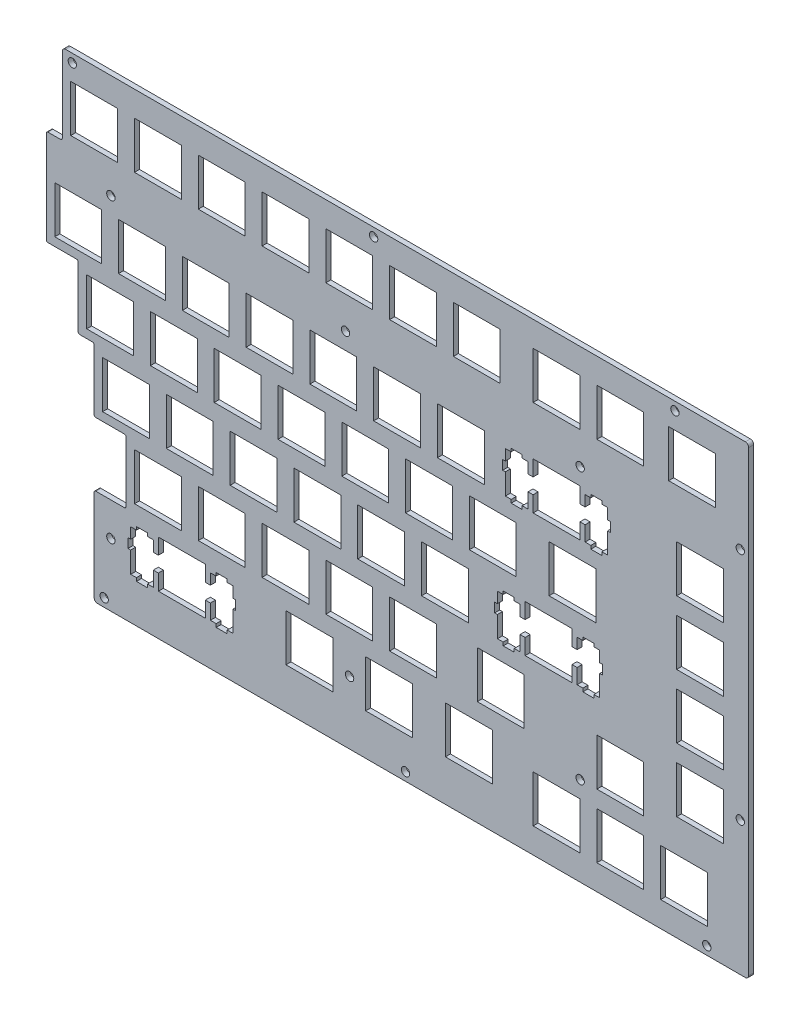
from build123d import *

# Parameters (mm, degrees)
MODEL_W                = 13.999
MODEL_H                = 13.99947
MODEL_W_2              = 13.9993
MODEL_H_2              = 13.99948
MODEL_W_3              = 14.0009
MODEL_H_3              = 13.9994
MODEL_W_4              = 14
MODEL_W_5              = 13.9994
MODEL_H_4              = 13.9992
MODEL_W_6              = 13.9998
MODEL_W_7              = 13.99955
MODEL_W_8              = 14.0007
MODEL_W_9              = 14.001
MODEL_W_10             = 13.99954
MODEL_H_5              = 13.999
EXTRUDE_1_DEPTH        = 1.5
EXTRUDE_2_DEPTH        = 1.5
SKETCH_2_R             = 1.25
CUT_EXTRUDE_1_DEPTH    = 3
FILLET_1_R             = 1
PATTERN_LINEAR_1_COUNT = 3
PATTERN_LINEAR_1_PITCH = 90
SKETCH_3_R             = 1.25
CUT_EXTRUDE_2_DEPTH    = 3
PATTERN_LINEAR_2_COUNT = 3
PATTERN_LINEAR_2_PITCH = 70
FILLET_2_R             = 0.5
SKETCH_4_R             = 1.25
CUT_EXTRUDE_3_DEPTH    = 10


with BuildPart() as part:
    # Model → 凸台-拉伸1 (new body)
    with BuildSketch(Plane.XY):
        Polygon((4.85693, 129.021), (204.883, 129.021), (204.883, 0.434082), (14.38193, 0.434082), (14.38193, 24.241), (23.90693, 24.241), (23.90693, 43.291), (14.38193, 43.291), (14.38193, 62.341), (9.61893, 62.341), (9.61893, 81.391), (0.09393, 81.391), (0.09393, 109.971), (4.85693, 109.971), align=None)
        with Locations((152.4945, 9.959765)):
            Rectangle(MODEL_W, MODEL_H, mode=Mode.SUBTRACT)
        with Locations((171.5445, 9.959765)):
            Rectangle(MODEL_W, MODEL_H, mode=Mode.SUBTRACT)
        with Locations((190.5945, 9.959765)):
            Rectangle(MODEL_W, MODEL_H, mode=Mode.SUBTRACT)
        Polygon((33.5759, 21.722), (33.5759, 17.0215), (32.0504, 17.0215), (32.0504, 20.2517), (30.3251, 20.2517), (30.3251, 21.1722), (27.0261, 21.1722), (27.0261, 20.2517), (25.3008, 20.2517), (25.3008, 17.0215), (24.4753, 17.0215), (24.4753, 14.2227), (25.3008, 14.2227), (25.3008, 7.95267), (27.0261, 7.95267), (27.0261, 6.97286), (30.3251, 6.97286), (30.3251, 7.95267), (32.0504, 7.95267), (32.0504, 12.4216), (33.5759, 12.4216), (33.5759, 7.72252), (47.5753, 7.72252), (47.5753, 12.4216), (49.101, 12.4216), (49.101, 7.95267), (50.8247, 7.95267), (50.8247, 6.97286), (54.1253, 6.97286), (54.1253, 7.95267), (55.8504, 7.95267), (55.8504, 14.2227), (56.6759, 14.2227), (56.6759, 17.0215), (55.8504, 17.0215), (55.8504, 20.2517), (54.1253, 20.2517), (54.1253, 21.1722), (50.8247, 21.1722), (50.8247, 20.2517), (49.101, 20.2517), (49.101, 17.0215), (47.5753, 17.0215), (47.5753, 21.722), align=None, mode=Mode.SUBTRACT)
        with Locations((78.67565, 14.72226)):
            Rectangle(MODEL_W_2, MODEL_H_2, mode=Mode.SUBTRACT)
        with Locations((102.48755, 14.72226)):
            Rectangle(MODEL_W_3, MODEL_H_2, mode=Mode.SUBTRACT)
        with Locations((126.3005, 14.72226)):
            Rectangle(MODEL_W, MODEL_H_2, mode=Mode.SUBTRACT)
        with Locations((171.5445, 29.0097)):
            Rectangle(MODEL_W, MODEL_H_3, mode=Mode.SUBTRACT)
        with Locations((33.43185, 33.7722)):
            Rectangle(MODEL_W_2, MODEL_H_3, mode=Mode.SUBTRACT)
        with Locations((52.48185, 33.7722)):
            Rectangle(MODEL_W_2, MODEL_H_3, mode=Mode.SUBTRACT)
        with Locations((71.53185, 33.7722)):
            Rectangle(MODEL_W_2, MODEL_H_3, mode=Mode.SUBTRACT)
        with Locations((90.58185, 33.7722)):
            Rectangle(MODEL_W_2, MODEL_H_3, mode=Mode.SUBTRACT)
        with Locations((109.632, 33.7722)):
            Rectangle(MODEL_W_4, MODEL_H_3, mode=Mode.SUBTRACT)
        with Locations((135.8255, 33.7722)):
            Rectangle(MODEL_W, MODEL_H_3, mode=Mode.SUBTRACT)
        with Locations((195.357, 33.7722)):
            Rectangle(MODEL_W_4, MODEL_H_3, mode=Mode.SUBTRACT)
        Polygon((143.112, 59.8219), (143.112, 55.1215), (141.588, 55.1215), (141.588, 58.3516), (139.863, 58.3516), (139.863, 59.2723), (136.562, 59.2723), (136.562, 58.3516), (134.837, 58.3516), (134.837, 55.1215), (134.013, 55.1215), (134.013, 52.3226), (134.837, 52.3226), (134.837, 46.0527), (136.562, 46.0527), (136.562, 45.0716), (139.863, 45.0716), (139.863, 46.0527), (141.588, 46.0527), (141.588, 50.5217), (143.112, 50.5217), (143.112, 45.8227), (157.113, 45.8227), (157.113, 50.5217), (158.637, 50.5217), (158.637, 46.0527), (160.362, 46.0527), (160.362, 45.0716), (163.663, 45.0716), (163.663, 46.0527), (165.388, 46.0527), (165.388, 52.3226), (166.212, 52.3226), (166.212, 55.1215), (165.388, 55.1215), (165.388, 58.3516), (163.663, 58.3516), (163.663, 59.2723), (160.362, 59.2723), (160.362, 58.3516), (158.637, 58.3516), (158.637, 55.1215), (157.113, 55.1215), (157.113, 59.8219), align=None, mode=Mode.SUBTRACT)
        with Locations((23.9069, 52.8223)):
            Rectangle(MODEL_W_5, MODEL_H_4, mode=Mode.SUBTRACT)
        with Locations((42.95685, 52.8223)):
            Rectangle(MODEL_W_2, MODEL_H_4, mode=Mode.SUBTRACT)
        with Locations((62.00685, 52.8223)):
            Rectangle(MODEL_W_2, MODEL_H_4, mode=Mode.SUBTRACT)
        with Locations((81.05685, 52.8223)):
            Rectangle(MODEL_W_2, MODEL_H_4, mode=Mode.SUBTRACT)
        with Locations((100.1071, 52.8223)):
            Rectangle(MODEL_W_6, MODEL_H_4, mode=Mode.SUBTRACT)
        with Locations((119.157, 52.8223)):
            Rectangle(MODEL_W_4, MODEL_H_4, mode=Mode.SUBTRACT)
        with Locations((195.357, 52.8223)):
            Rectangle(MODEL_W_4, MODEL_H_4, mode=Mode.SUBTRACT)
        with Locations((19.1444, 71.8723)):
            Rectangle(MODEL_W_5, MODEL_H_4, mode=Mode.SUBTRACT)
        with Locations((38.19435, 71.8723)):
            Rectangle(MODEL_W_2, MODEL_H_4, mode=Mode.SUBTRACT)
        with Locations((57.24435, 71.8723)):
            Rectangle(MODEL_W_2, MODEL_H_4, mode=Mode.SUBTRACT)
        with Locations((76.29435, 71.8723)):
            Rectangle(MODEL_W_2, MODEL_H_4, mode=Mode.SUBTRACT)
        with Locations((95.34435, 71.8723)):
            Rectangle(MODEL_W_2, MODEL_H_4, mode=Mode.SUBTRACT)
        with Locations((114.3945, 71.8723)):
            Rectangle(MODEL_W, MODEL_H_4, mode=Mode.SUBTRACT)
        with Locations((133.4445, 71.8723)):
            Rectangle(MODEL_W, MODEL_H_4, mode=Mode.SUBTRACT)
        with Locations((157.257, 71.8723)):
            Rectangle(MODEL_W_4, MODEL_H_4, mode=Mode.SUBTRACT)
        with Locations((195.357, 71.8723)):
            Rectangle(MODEL_W_4, MODEL_H_4, mode=Mode.SUBTRACT)
        Polygon((145.493, 97.9219), (145.493, 93.2215), (143.969, 93.2215), (143.969, 96.4516), (142.244, 96.4516), (142.244, 97.3723), (138.943, 97.3723), (138.943, 96.4516), (137.218, 96.4516), (137.218, 93.2215), (136.394, 93.2215), (136.394, 90.4226), (137.218, 90.4226), (137.218, 84.1527), (138.943, 84.1527), (138.943, 83.1716), (142.244, 83.1716), (142.244, 84.1527), (143.969, 84.1527), (143.969, 88.6217), (145.493, 88.6217), (145.493, 83.9227), (159.494, 83.9227), (159.494, 88.6217), (161.018, 88.6217), (161.018, 84.1527), (162.743, 84.1527), (162.743, 83.1716), (166.044, 83.1716), (166.044, 84.1527), (167.768, 84.1527), (167.768, 90.4226), (168.593, 90.4226), (168.593, 93.2215), (167.768, 93.2215), (167.768, 96.4516), (166.044, 96.4516), (166.044, 97.3723), (162.743, 97.3723), (162.743, 96.4516), (161.018, 96.4516), (161.018, 93.2215), (159.494, 93.2215), (159.494, 97.9219), align=None, mode=Mode.SUBTRACT)
        with Locations((9.619425, 90.9223)):
            Rectangle(MODEL_W_7, MODEL_H_4, mode=Mode.SUBTRACT)
        with Locations((28.66935, 90.9223)):
            Rectangle(MODEL_W_2, MODEL_H_4, mode=Mode.SUBTRACT)
        with Locations((47.71935, 90.9223)):
            Rectangle(MODEL_W_2, MODEL_H_4, mode=Mode.SUBTRACT)
        with Locations((66.76935, 90.9223)):
            Rectangle(MODEL_W_2, MODEL_H_4, mode=Mode.SUBTRACT)
        with Locations((85.81935, 90.9223)):
            Rectangle(MODEL_W_2, MODEL_H_4, mode=Mode.SUBTRACT)
        with Locations((104.86865, 90.9223)):
            Rectangle(MODEL_W_8, MODEL_H_4, mode=Mode.SUBTRACT)
        with Locations((123.9185, 90.9223)):
            Rectangle(MODEL_W_9, MODEL_H_4, mode=Mode.SUBTRACT)
        with Locations((195.357, 90.9223)):
            Rectangle(MODEL_W_4, MODEL_H_4, mode=Mode.SUBTRACT)
        with Locations((14.38193, 119.4975)):
            Rectangle(MODEL_W_10, MODEL_H_5, mode=Mode.SUBTRACT)
        with Locations((33.43185, 119.4975)):
            Rectangle(MODEL_W_2, MODEL_H_5, mode=Mode.SUBTRACT)
        with Locations((52.48185, 119.4975)):
            Rectangle(MODEL_W_2, MODEL_H_5, mode=Mode.SUBTRACT)
        with Locations((71.53185, 119.4975)):
            Rectangle(MODEL_W_2, MODEL_H_5, mode=Mode.SUBTRACT)
        with Locations((90.58185, 119.4975)):
            Rectangle(MODEL_W_2, MODEL_H_5, mode=Mode.SUBTRACT)
        with Locations((109.632, 119.4975)):
            Rectangle(MODEL_W_4, MODEL_H_5, mode=Mode.SUBTRACT)
        with Locations((128.682, 119.4975)):
            Rectangle(MODEL_W_4, MODEL_H_5, mode=Mode.SUBTRACT)
        with Locations((152.4945, 119.4975)):
            Rectangle(MODEL_W, MODEL_H_5, mode=Mode.SUBTRACT)
        with Locations((171.5445, 119.4975)):
            Rectangle(MODEL_W, MODEL_H_5, mode=Mode.SUBTRACT)
        with Locations((192.9755, 119.4975)):
            Rectangle(MODEL_W, MODEL_H_5, mode=Mode.SUBTRACT)
    extrude(amount=EXTRUDE_1_DEPTH)

    # 草图1 → 凸台-拉伸2 (add)
    with BuildSketch(Plane.XY.offset(1.5)):
        Polygon((14.38193, -4.565918), (209.883, -4.565918), (209.883, 134.021), (4.85693, 134.021), (4.85693, 129.021), (204.883, 129.021), (204.883, 0.434082), (14.38193, 0.434082), align=None)
    extrude(amount=-EXTRUDE_2_DEPTH)

    # 草图2 → 切除-拉伸1 (cut)
    with BuildSketch(Plane.XY.offset(1.5)):
        with Locations((7.85693, 131.521)):
            Circle(SKETCH_2_R)
        with Locations((17.38193, -2.065918)):
            Circle(SKETCH_2_R)
    cut_extrude_1 = extrude(amount=-CUT_EXTRUDE_1_DEPTH, mode=Mode.SUBTRACT)

    # 圆角1
    fillet_1_edges = [part.edges().sort_by_distance(p)[0] for p in [
        (14.38193, -4.565918, 0.75),
        (4.85693, 134.021, 0.75),
        (209.883, 134.021, 0.75),
        (209.883, -4.565918, 0.75),
    ]]
    fillet(fillet_1_edges, radius=FILLET_1_R)

    # 阵列(线性)1: 切除-拉伸1 ×3
    with Locations(*[(i * PATTERN_LINEAR_1_PITCH, 0, 0) for i in range(1, PATTERN_LINEAR_1_COUNT)]):
        add(cut_extrude_1, mode=Mode.SUBTRACT)

    # 草图3 → 切除-拉伸2 (cut)
    with BuildSketch(Plane.XY.offset(1.5)):
        with Locations((207.383, 35.434082)):
            Circle(SKETCH_3_R)
    cut_extrude_2 = extrude(amount=-CUT_EXTRUDE_2_DEPTH, mode=Mode.SUBTRACT)

    # 阵列(线性)2: 切除-拉伸2 ×3
    with Locations(*[(0, i * PATTERN_LINEAR_2_PITCH, 0) for i in range(1, PATTERN_LINEAR_2_COUNT)]):
        add(cut_extrude_2, mode=Mode.SUBTRACT)

    # 圆角2
    fillet_2_edges = [part.edges().sort_by_distance(p)[0] for p in [
        (14.38193, 24.241, 0.75),
        (23.90693, 24.241, 0.75),
        (23.90693, 43.291, 0.75),
        (14.38193, 43.291, 0.75),
        (14.38193, 62.341, 0.75),
        (9.61893, 62.341, 0.75),
        (9.61893, 81.391, 0.75),
        (0.09393, 81.391, 0.75),
        (0.09393, 109.971, 0.75),
        (4.85693, 109.971, 0.75),
    ]]
    fillet(fillet_2_edges, radius=FILLET_2_R)

    # 草图4 → 切除-拉伸3 (cut)
    with BuildSketch(Plane.XY.offset(1.5)):
        with Locations((19.38193, 102.9219)):
            Circle(SKETCH_4_R)
        with Locations((19.38193, 14.241)):
            Circle(SKETCH_4_R)
        with Locations((159.545, 21.9595)):
            Circle(SKETCH_4_R)
        with Locations((159.545, 102.9219)):
            Circle(SKETCH_4_R)
        with Locations((89.463465, 102.9219)):
            Circle(SKETCH_4_R)
        with Locations((90.6753, 14.241)):
            Circle(SKETCH_4_R)
    extrude(amount=-CUT_EXTRUDE_3_DEPTH, mode=Mode.SUBTRACT)


solid = part.part
